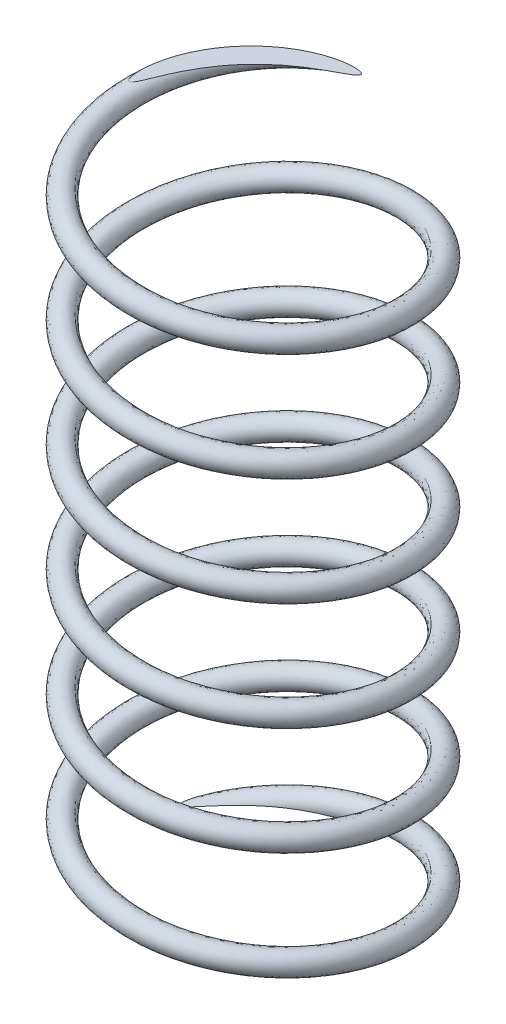
from build123d import *

# Parameters (mm, degrees)
SWEEP1_PITCH           = 15.24
SWEEP1_HEIGHT          = 95.25
SWEEP1_RADIUS          = 19.05
SWEEP1_START_ANGLE     = -90
SKETCH5_R              = 1.5875
SKETCH6_R              = 26.889629738
CUT_EXTRUDE1_DEPTH     = 99.710853645
CUT_EXTRUDE5_START     = -0.762
CUT_EXTRUDE5_OUTLINE_R = 29.638408028
CUT_EXTRUDE5_DEPTH     = 3.6195


# Read off the part's stored shape, not the designer's step: Cut-Extrude5
with BuildPart() as part:
    # Sweep1: sweep along a helix
    with BuildLine() as sweep1_path:
        add(Helix(SWEEP1_PITCH, SWEEP1_HEIGHT, SWEEP1_RADIUS, center=(0, 0, 0), direction=(0, 1, 0), lefthand=True, mode=Mode.PRIVATE).rotate(Axis((0, 0, 0), (0, 1, 0)), SWEEP1_START_ANGLE))
    # Sketch5 → Sweep1 (sweep)
    with BuildSketch(Plane.XY):
        with Locations((-19.05, 0)):
            Circle(SKETCH5_R)
    sweep(path=sweep1_path.line, is_frenet=True)

    # Sketch6 → Cut-Extrude1 (cut, through all)
    with BuildSketch(Plane(origin=(0, 2.54, 0), x_dir=(1, 0, 0), z_dir=(0, 1, 0))):
        Circle(SKETCH6_R)
    extrude(amount=-CUT_EXTRUDE1_DEPTH, mode=Mode.SUBTRACT)

    # Cut-Extrude5 outline → Cut-Extrude5 (cut)
    with BuildSketch(Plane(origin=(0, 93.98, 0), x_dir=(1, 0, 0), z_dir=(0, 1, 0)).offset(CUT_EXTRUDE5_START)):
        Circle(CUT_EXTRUDE5_OUTLINE_R)
    extrude(amount=CUT_EXTRUDE5_DEPTH, mode=Mode.SUBTRACT)


solid = part.part
